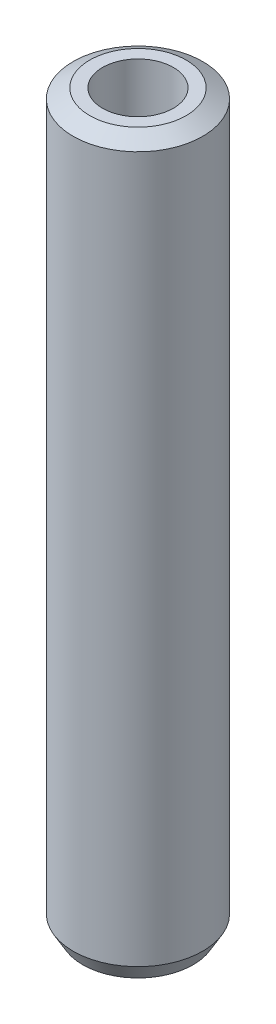
from build123d import *
from OCP.BRepFilletAPI import BRepFilletAPI_MakeChamfer

# Parameters (mm, degrees)
SKETCH1_R           = 22.5
BOSS_EXTRUDE1_DEPTH = 254.082430997
SKETCH2_R           = 12.29794178
CUT_EXTRUDE1_DEPTH  = 257.067143033
CHAMFER1_SIZE       = 3.327620151
CHAMFER1_SIZE2      = 5.763607169


with BuildPart() as part:
    # Sketch1 → Boss-Extrude1 (new body)
    with BuildSketch(Plane(origin=(0, 0, 0), x_dir=(1, 0, 0), z_dir=(0, 1, 0))):
        Circle(SKETCH1_R)
    extrude(amount=BOSS_EXTRUDE1_DEPTH)

    # Sketch2 → Cut-Extrude1 (cut, through all)
    with BuildSketch(Plane(origin=(0, 0, 0), x_dir=(1, 0, 0), z_dir=(0, 1, 0))):
        Circle(SKETCH2_R)
    extrude(amount=CUT_EXTRUDE1_DEPTH, mode=Mode.SUBTRACT)

    # Chamfer1: one chamfer whose edges measure the first distance from different faces: ONE call of the kernel's chamfer builder (chamfer() names one face for all edges)
    chamfer1_edges_1 = [part.edges().sort_by_distance(p)[0] for p in [
        (-22.5, 254.082430997, 0),
    ]]
    chamfer1_side_1 = [part.faces().sort_by_distance(p)[0] for p in [
        (-22.5, 127.041215498, 0),
    ]]
    chamfer1_edges_2 = [part.edges().sort_by_distance(p)[0] for p in [
        (-22.5, 0, 0),
    ]]
    chamfer1_side_2 = [part.faces().sort_by_distance(p)[0] for p in [
        (-21.863603897, 0, 0),
    ]]
    chamfer1 = BRepFilletAPI_MakeChamfer(part.part.solid().wrapped)
    for e in chamfer1_edges_1:
        chamfer1.Add(CHAMFER1_SIZE, CHAMFER1_SIZE2, e.wrapped, chamfer1_side_1[0].wrapped)  # the first distance lies on this face
    for e in chamfer1_edges_2:
        chamfer1.Add(CHAMFER1_SIZE, CHAMFER1_SIZE2, e.wrapped, chamfer1_side_2[0].wrapped)  # the first distance lies on this face
    add(Compound.cast(chamfer1.Shape()), mode=Mode.REPLACE)


solid = part.part
